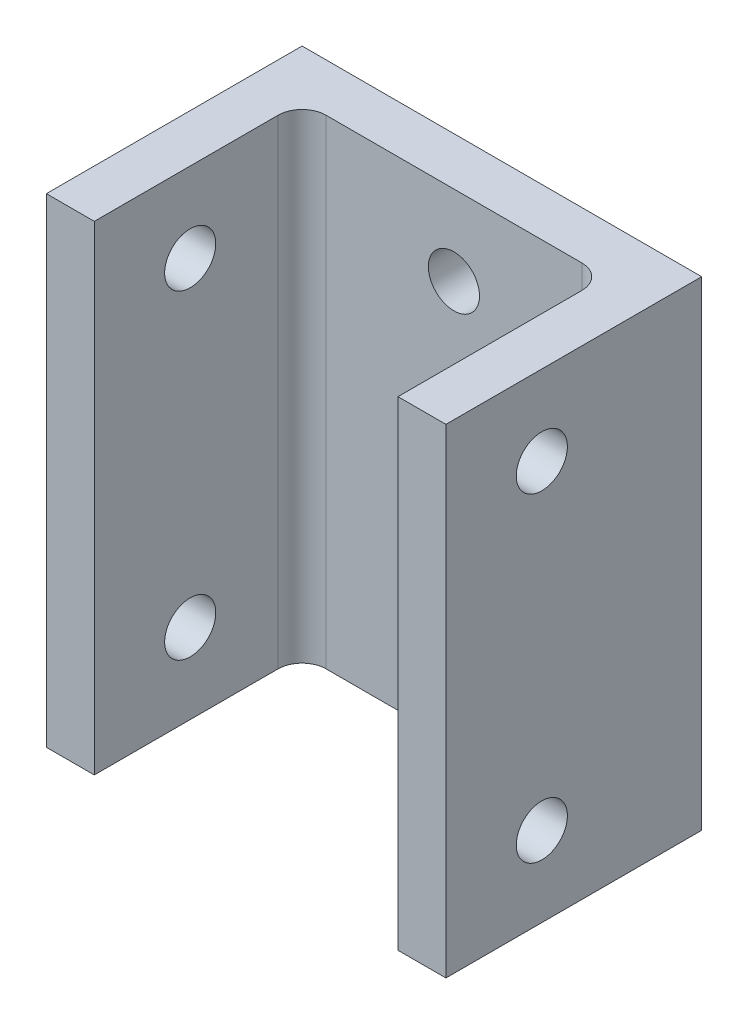
from build123d import *

# Parameters (mm, degrees)
SKETCH_1_W          = 25
SKETCH_1_H          = 30
EXTRUDE_1_DEPTH     = 3
SKETCH_2_W          = 3
SKETCH_2_H          = 30
EXTRUDE_2_DEPTH     = 15
SKETCH_3_R          = 1.6
CUT_EXTRUDE_1_DEPTH = 30
SKETCH_4_R          = 1.6
CUT_EXTRUDE_2_DEPTH = 30
SKETCH_5_W          = 9.97361981
SKETCH_5_H          = 31.604997134
CUT_EXTRUDE_3_DEPTH = 29
FILLET_1_R          = 1.5


with BuildPart() as part:
    # 草图1 → 凸台-拉伸1 (new body)
    with BuildSketch(Plane.XY):
        with Locations((266.488347113, -58.108866795)):
            Rectangle(SKETCH_1_W, SKETCH_1_H)
    extrude(amount=EXTRUDE_1_DEPTH)

    # 草图2 → 凸台-拉伸2 (add)
    with BuildSketch(Plane.XY.offset(3)):
        with Locations((255.488347113, -58.108866795)):
            Rectangle(SKETCH_2_W, SKETCH_2_H)
        with Locations((277.488347113, -58.108866795)):
            Rectangle(SKETCH_2_W, SKETCH_2_H)
    extrude(amount=EXTRUDE_2_DEPTH)

    # 草图3 → 切除-拉伸1 (cut)
    with BuildSketch(Plane.ZY.offset(-253.988347113)):
        with Locations((10, -48.108866795)):
            Circle(SKETCH_3_R)
        with Locations((10, -68.108866795)):
            Circle(SKETCH_3_R)
    extrude(amount=-CUT_EXTRUDE_1_DEPTH, mode=Mode.SUBTRACT)

    # 草图4 → 切除-拉伸2 (cut)
    with BuildSketch(Plane.XY.offset(3)):
        with Locations((266.488347113, -48.108866795)):
            Circle(SKETCH_4_R)
        with Locations((266.488347113, -68.108866795)):
            Circle(SKETCH_4_R)
    extrude(amount=-CUT_EXTRUDE_2_DEPTH, mode=Mode.SUBTRACT)

    # 草图5 → 切除-拉伸3 (cut)
    with BuildSketch(Plane.ZY.offset(-253.988347113)):
        with Locations((20.986809905, -58.911365362)):
            Rectangle(SKETCH_5_W, SKETCH_5_H)
    extrude(amount=-CUT_EXTRUDE_3_DEPTH, mode=Mode.SUBTRACT)

    # 圆角1
    fillet_1_edges = [part.edges().sort_by_distance(p)[0] for p in [
        (256.988347113, -58.108866795, 3),
        (275.988347113, -58.108866795, 3),
    ]]
    fillet(fillet_1_edges, radius=FILLET_1_R)


solid = part.part
